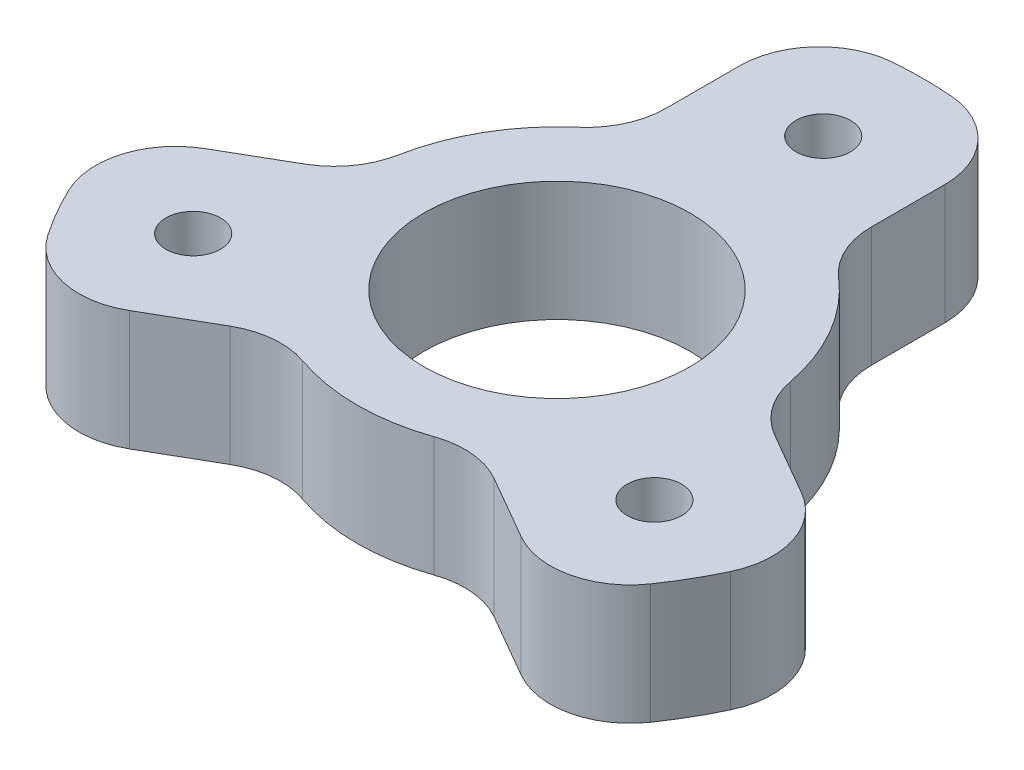
from build123d import *

# Parameters (mm, degrees)
SKETCH_1_R      = 2.05
SKETCH_1_R_2    = 10
EXTRUDE_1_DEPTH = 9


with BuildPart() as part:
    # 草图1 → 凸台-拉伸1 (new body)
    with BuildSketch(Plane(origin=(0, 0, 0), x_dir=(1, 0, 0), z_dir=(0, 1, 0))):
        with BuildLine():
            Line((14.704155596, -17.395040677), (9.917876512, -14.631681159))
            ThreePointArc((9.917876512, -14.631681159), (7.480767641, -13.854295805), (4.941340366, -14.162738273))
            ThreePointArc((4.941340366, -14.162738273), (0, -15), (-4.941340366, -14.162738273))
            ThreePointArc((-4.941340366, -14.162738273), (-7.480767641, -13.854295805), (-9.917876512, -14.631681159))
            Line((-9.917876512, -14.631681159), (-14.704155596, -17.395040677))
            ThreePointArc((-14.704155596, -17.395040677), (-19.024845186, -18.051731922), (-22.644850181, -15.603229162))
            ThreePointArc((-22.644850181, -15.603229162), (-23.815698604, -13.75), (-24.835217926, -11.809400941))
            ThreePointArc((-24.835217926, -11.809400941), (-25.14568102, -7.450133273), (-22.416624924, -4.036651949))
            Line((-22.416624924, -4.036651949), (-17.63034584, -1.273292432))
            ThreePointArc((-17.63034584, -1.273292432), (-15.738555939, 0.448613085), (-14.735961315, 2.802042851))
            ThreePointArc((-14.735961315, 2.802042851), (-12.990381057, 7.5), (-9.794620948, 11.360695422))
            ThreePointArc((-9.794620948, 11.360695422), (-8.257788298, 13.405682719), (-7.712469328, 15.904973591))
            Line((-7.712469328, 15.904973591), (-7.712469328, 21.431692626))
            ThreePointArc((-7.712469328, 21.431692626), (-6.120835834, 25.501865196), (-2.190367745, 27.412630103))
            ThreePointArc((-2.190367745, 27.412630103), (0, 27.5), (2.190367745, 27.412630103))
            ThreePointArc((2.190367745, 27.412630103), (6.120835834, 25.501865196), (7.712469328, 21.431692626))
            Line((7.712469328, 21.431692626), (7.712469328, 15.904973591))
            ThreePointArc((7.712469328, 15.904973591), (8.257788298, 13.405682719), (9.794620948, 11.360695422))
            ThreePointArc((9.794620948, 11.360695422), (12.990381057, 7.5), (14.735961315, 2.802042851))
            ThreePointArc((14.735961315, 2.802042851), (15.738555939, 0.448613085), (17.63034584, -1.273292432))
            Line((17.63034584, -1.273292432), (22.416624924, -4.036651949))
            ThreePointArc((22.416624924, -4.036651949), (25.14568102, -7.450133273), (24.835217926, -11.809400941))
            ThreePointArc((24.835217926, -11.809400941), (23.815698604, -13.75), (22.644850181, -15.603229162))
            ThreePointArc((22.644850181, -15.603229162), (19.024845186, -18.051731922), (14.704155596, -17.395040677))
        make_face()
        with Locations((0, 20)):
            Circle(SKETCH_1_R, mode=Mode.SUBTRACT)
        with Locations((17.320508076, -10)):
            Circle(SKETCH_1_R, mode=Mode.SUBTRACT)
        with Locations((-17.320508076, -10)):
            Circle(SKETCH_1_R, mode=Mode.SUBTRACT)
        Circle(SKETCH_1_R_2, mode=Mode.SUBTRACT)
    extrude(amount=EXTRUDE_1_DEPTH)


solid = part.part
